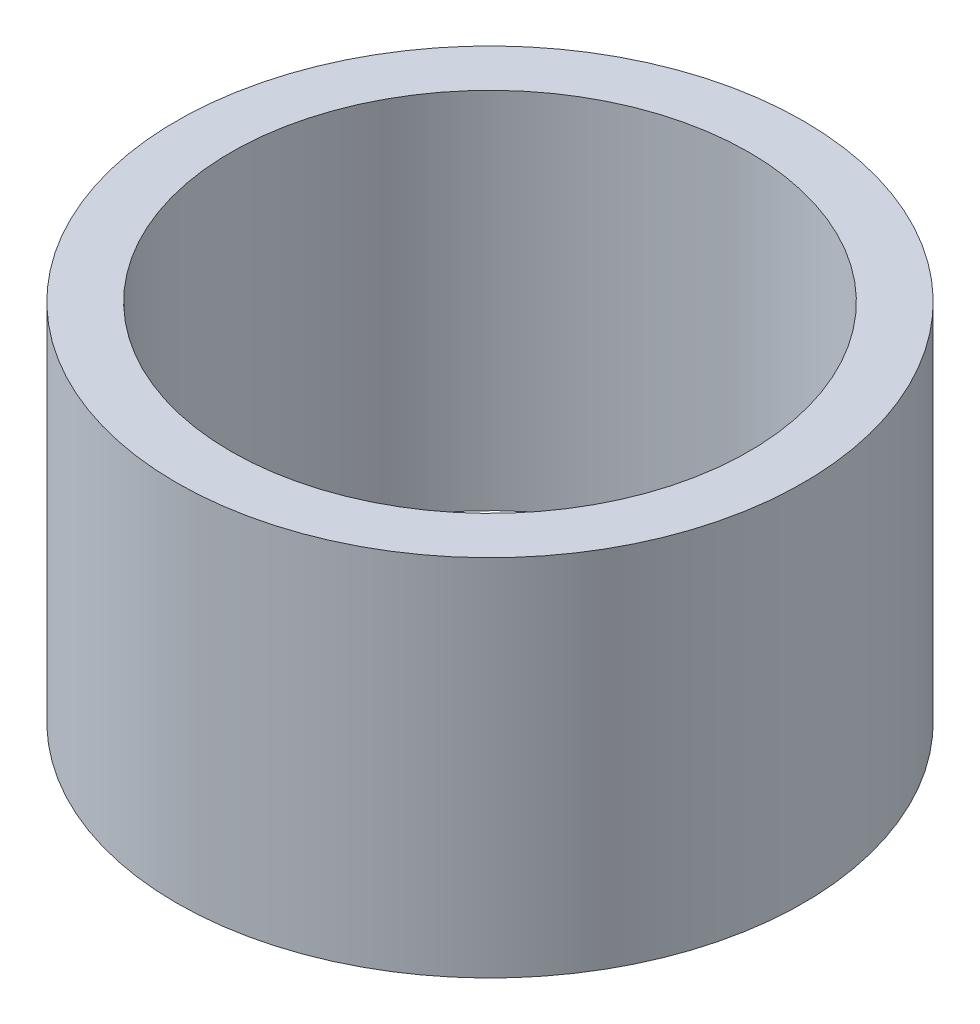
from build123d import *

# Parameters (mm, degrees)
SKETCH1_R           = 27.5
BOSS_EXTRUDE1_DEPTH = 31.941207475
SKETCH2_R           = 22.733153721
CUT_EXTRUDE1_DEPTH  = 51.326342356


with BuildPart() as part:
    # Sketch1 → Boss-Extrude1 (new body)
    with BuildSketch(Plane(origin=(0, 0, 0), x_dir=(1, 0, 0), z_dir=(0, 1, 0))):
        Circle(SKETCH1_R)
    extrude(amount=BOSS_EXTRUDE1_DEPTH)

    # Sketch2 → Cut-Extrude1 (cut, through all)
    with BuildSketch(Plane(origin=(0, 0, 0), x_dir=(1, 0, 0), z_dir=(0, 1, 0))):
        Circle(SKETCH2_R)
    extrude(amount=CUT_EXTRUDE1_DEPTH, mode=Mode.SUBTRACT)


solid = part.part
